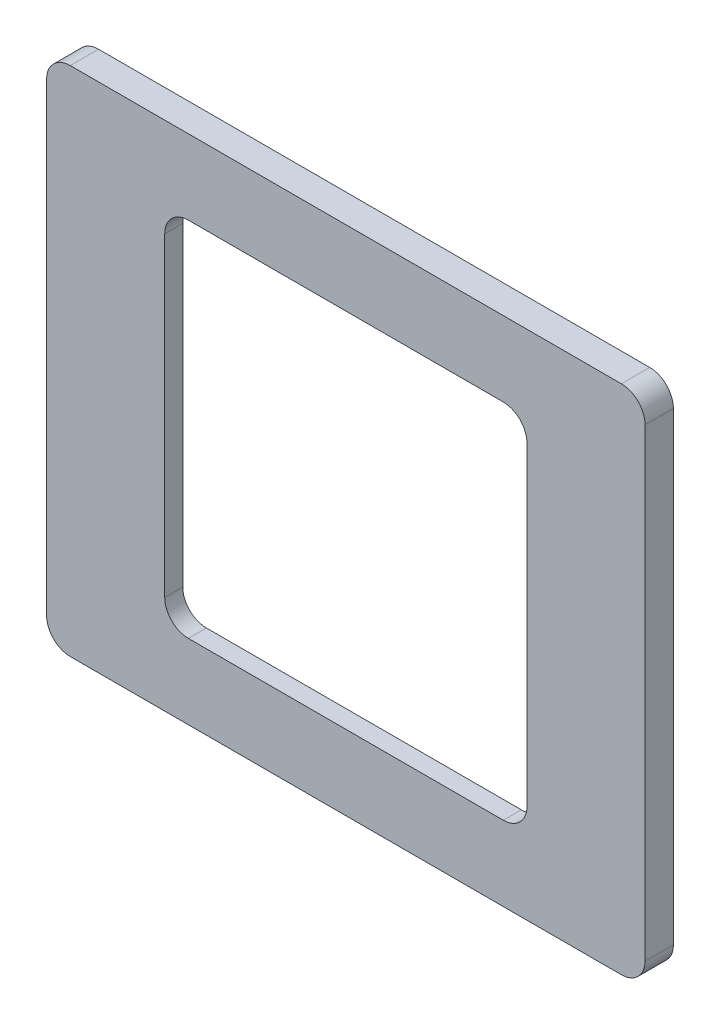
from build123d import *

# Parameters (mm, degrees)
SKETCH1_W           = 76
SKETCH1_H           = 3.6
BOSS_EXTRUDE1_DEPTH = 65
SKETCH2_W           = 50.29
SKETCH2_H           = 50.29
CUT_EXTRUDE1_DEPTH  = 1.31
SKETCH3_W           = 46
SKETCH3_H           = 46
CUT_EXTRUDE2_DEPTH  = 76.327578615
FILLET1_R           = 3


with BuildPart() as part:
    # Sketch1 → Boss-Extrude1 (new body)
    with BuildSketch(Plane(origin=(0, 0, 0), x_dir=(1, 0, 0), z_dir=(0, 1, 0))):
        with Locations((0, 1.8)):
            Rectangle(SKETCH1_W, SKETCH1_H)
    extrude(amount=BOSS_EXTRUDE1_DEPTH)

    # Sketch2 → Cut-Extrude1 (cut)
    with BuildSketch(Plane(origin=(0, 0, -3.6), x_dir=(-1, 0, 0), z_dir=(0, 0, -1))):
        with Locations((0, 32.5)):
            Rectangle(SKETCH2_W, SKETCH2_H)
    extrude(amount=-CUT_EXTRUDE1_DEPTH, mode=Mode.SUBTRACT)

    # Sketch3 → Cut-Extrude2 (cut, through all)
    with BuildSketch(Plane(origin=(0, 0, -2.29), x_dir=(-1, 0, 0), z_dir=(0, 0, -1))):
        with Locations((0, 32.5)):
            Rectangle(SKETCH3_W, SKETCH3_H)
    extrude(amount=-CUT_EXTRUDE2_DEPTH, mode=Mode.SUBTRACT)

    # Fillet1
    fillet1_edges = [part.edges().sort_by_distance(p)[0] for p in [
        (-23, 55.5, -1.145),
        (23, 55.5, -1.145),
        (23, 9.5, -1.145),
        (-23, 9.5, -1.145),
        (38, 0, -1.8),
        (-38, 0, -1.8),
        (-38, 65, -1.8),
        (38, 65, -1.8),
    ]]
    fillet(fillet1_edges, radius=FILLET1_R)


solid = part.part
